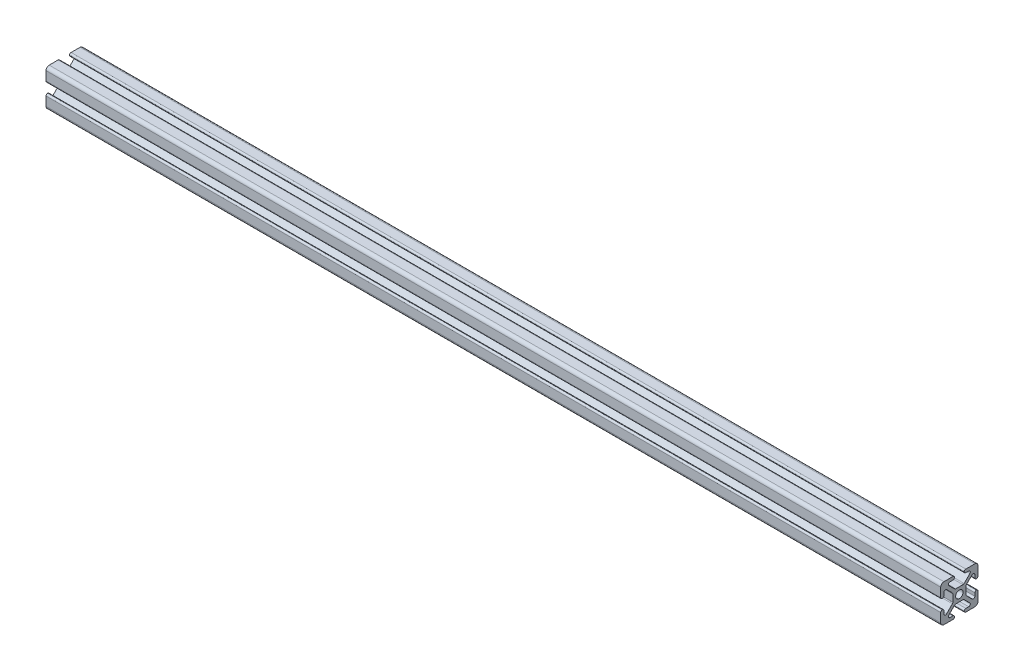
from build123d import *

# Parameters (mm, degrees)
SKETCH1_R           = 2.5
BOSS_EXTRUDE1_DEPTH = 600
FILLET1_R           = 1.065
FILLET2_R           = 2.13


with BuildPart() as part:
    # Sketch1 → Boss-Extrude1 (new body)
    with BuildSketch(Plane.YZ):
        Polygon((-12.5, -3.25), (-12.5, -12.5), (-3.25, -12.5), (-3.25, -10.37), (-8.863862556, -10.37), (-2.873862556, -4.38), (2.873862556, -4.38), (8.863862556, -10.37), (3.25, -10.37), (3.25, -12.5), (12.5, -12.5), (12.5, -3.25), (10.37, -3.25), (10.37, -8.863862556), (4.38, -2.873862556), (4.38, 2.873862556), (10.37, 8.863862556), (10.37, 3.25), (12.5, 3.25), (12.5, 12.5), (3.25, 12.5), (3.25, 10.37), (8.863862556, 10.37), (2.873862556, 4.38), (-2.873862556, 4.38), (-8.863862556, 10.37), (-3.25, 10.37), (-3.25, 12.5), (-12.5, 12.5), (-12.5, 3.25), (-10.37, 3.25), (-10.37, 8.863862556), (-4.38, 2.873862556), (-4.38, -2.873862556), (-10.37, -8.863862556), (-10.37, -3.25), align=None)
        with Locations(Location((0, 0, 0), (0, 0, 270))):
            Circle(SKETCH1_R, mode=Mode.SUBTRACT)
    extrude(amount=BOSS_EXTRUDE1_DEPTH)

    # Fillet1
    fillet1_edges = [part.edges().sort_by_distance(p)[0] for p in [
        (300, -10.37, -8.863862556),
        (300, 2.873862556, -4.38),
        (300, -2.873862556, -4.38),
        (300, -4.38, 2.873862556),
        (300, -4.38, -2.873862556),
        (300, -2.873862556, 4.38),
        (300, 2.873862556, 4.38),
        (300, 4.38, 2.873862556),
        (300, 4.38, -2.873862556),
        (300, -8.863862556, -10.37),
        (300, 8.863862556, -10.37),
        (300, 10.37, -8.863862556),
        (300, -10.37, 8.863862556),
        (300, -8.863862556, 10.37),
        (300, 10.37, 8.863862556),
        (300, 8.863862556, 10.37),
        (300, 12.5, 3.25),
        (300, -3.25, -12.5),
        (300, -10.37, 3.25),
        (300, 10.37, 3.25),
        (300, -10.37, -3.25),
        (300, -12.5, -3.25),
        (300, -12.5, 3.25),
        (300, 3.25, -10.37),
        (300, -3.25, -10.37),
        (300, 3.25, -12.5),
        (300, 10.37, -3.25),
        (300, 12.5, -3.25),
        (300, 3.25, 12.5),
        (300, 3.25, 10.37),
        (300, -3.25, 10.37),
        (300, -3.25, 12.5),
    ]]
    fillet(fillet1_edges, radius=FILLET1_R - 0.0001)  # a hair under: the kernel refuses the full size

    # Fillet2
    fillet2_edges = [part.edges().sort_by_distance(p)[0] for p in [
        (300, -12.5, 12.5),
        (300, 12.5, 12.5),
        (300, 12.5, -12.5),
        (300, -12.5, -12.5),
    ]]
    fillet(fillet2_edges, radius=FILLET2_R)


solid = part.part
